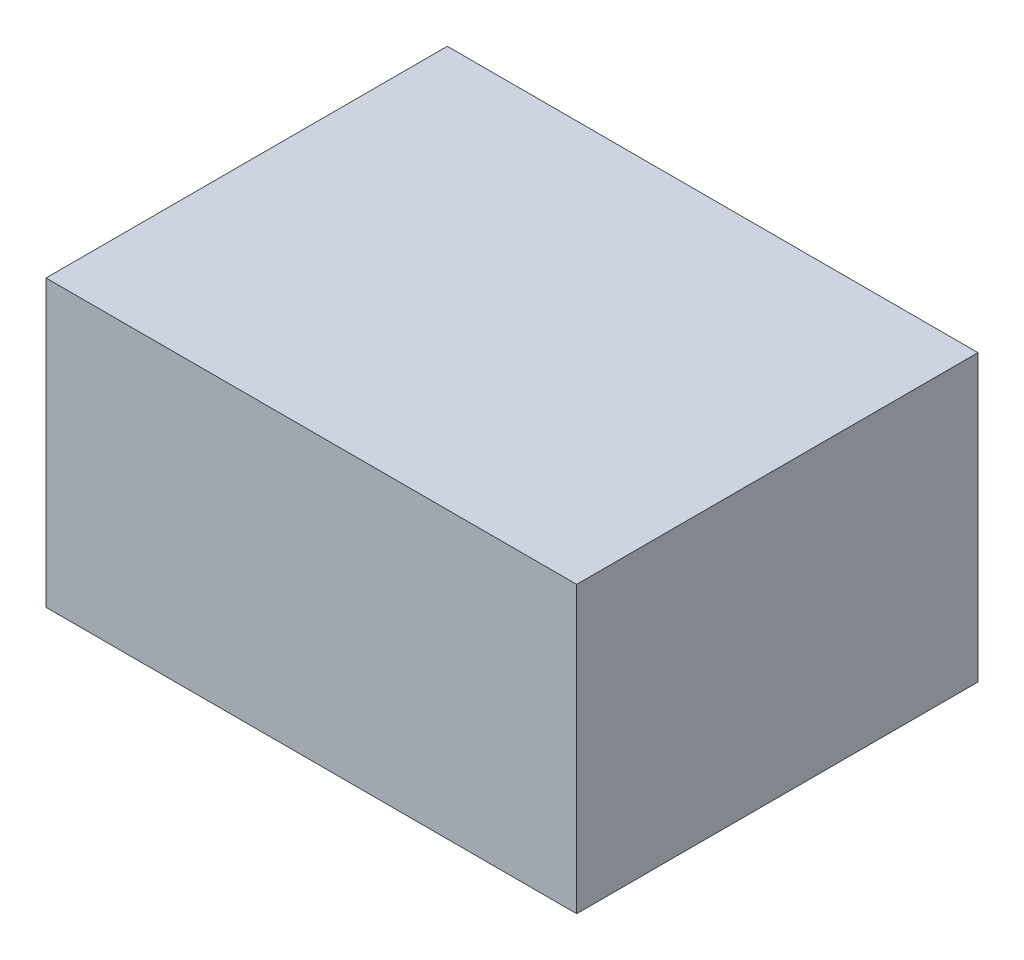
from build123d import *

# Parameters (mm, degrees)
SKETCH1_W           = 320
SKETCH1_H           = 242
BOSS_EXTRUDE1_DEPTH = 172


with BuildPart() as part:
    # Sketch1 → Boss-Extrude1 (new body)
    with BuildSketch(Plane(origin=(0, 0, 0), x_dir=(1, 0, 0), z_dir=(0, 1, 0))):
        Rectangle(SKETCH1_W, SKETCH1_H)
    extrude(amount=BOSS_EXTRUDE1_DEPTH)


solid = part.part
